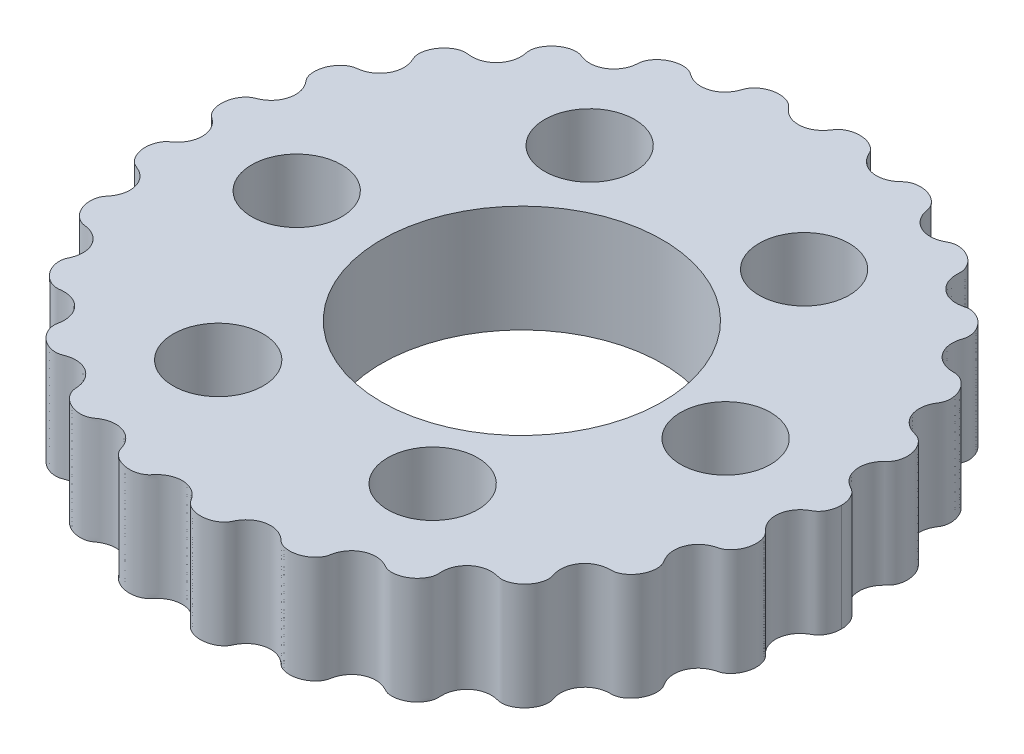
from build123d import *

# Parameters (mm, degrees)
BOSS_EXTRUDE2_DEPTH = 5
SKETCH3_R           = 2.1
CUT_EXTRUDE1_DEPTH  = 23.948222063
SKETCH5_R           = 6.55
CUT_EXTRUDE3_DEPTH  = 23.948222063


with BuildPart() as part:
    # Sketch2 → Boss-Extrude2 (new body)
    with BuildSketch(Plane(origin=(0, 0, 0), x_dir=(1, 0, 0), z_dir=(0, 1, 0))):
        with BuildLine():
            add(Edge.make_bspline(
                [(-15.4, -2.05e-07), (-15.4, 0.017963679), (-15.400999323, 0.054155556), (-15.405496281, 0.123245338), (-15.417452591, 0.205733526), (-15.435300776, 0.284760663), (-15.458936185, 0.363829619), (-15.4955307, 0.460103097), (-15.553831728, 0.577672483), (-15.628963253, 0.690475001), (-15.720523696, 0.795156023), (-15.809877897, 0.878529493), (-15.885972355, 0.939710108), (-15.965266266, 0.996877007), (-16.039390288, 1.060755514), (-16.10181304, 1.136526714), (-16.154322588, 1.219306401), (-16.208602379, 1.329232628), (-16.256294452, 1.468797029), (-16.288096989, 1.63808354), (-16.294503336, 1.881017734), (-16.252297954, 2.119867751), (-16.163760076, 2.344379995), (-16.042398431, 2.523139866), (-15.942454272, 2.628650364), (-15.845311895, 2.703603556), (-15.757199339, 2.750370948), (-15.664408515, 2.786732133), (-15.573413087, 2.826965618), (-15.463621848, 2.885729978), (-15.308968468, 2.990239319), (-15.13050378, 3.165844515), (-14.972147574, 3.434992694), (-14.89398566, 3.773341765), (-14.916927639, 4.080338657), (-14.995171131, 4.310200193), (-15.082412287, 4.468541764), (-15.150259424, 4.567703455), (-15.210025777, 4.642870065), (-15.270573612, 4.717648923), (-15.320176271, 4.800200328), (-15.36541674, 4.910918763), (-15.399338412, 5.049561371), (-15.416852166, 5.262398237), (-15.384340029, 5.500937279), (-15.304055964, 5.731023181), (-15.177986068, 5.941781476), (-15.047854274, 6.095731412), (-14.910789065, 6.208565406), (-14.777136669, 6.28441597), (-14.654566296, 6.325933494), (-14.550559852, 6.341335089), (-14.446683568, 6.355615029), (-14.344145813, 6.378219064), (-14.218558726, 6.416412376), (-14.049117894, 6.490187541), (-13.850381142, 6.623876695), (-13.649361582, 6.848376382), (-13.50607529, 7.152261708), (-13.462998346, 7.451002699), (-13.489971844, 7.692058116), (-13.539204569, 7.862350249), (-13.580286552, 7.968000164), (-13.618269725, 8.050352521), (-13.65443537, 8.133644282), (-13.67828368, 8.221362195), (-13.692937865, 8.335980748), (-13.690655581, 8.476153018), (-13.654303068, 8.685493104), (-13.545223723, 8.951238703), (-13.373056916, 9.183722449), (-13.149188349, 9.366304312), (-12.95326403, 9.463317901), (-12.811586107, 9.506241008), (-12.686731421, 9.522483534), (-12.583488536, 9.516968428), (-12.481158126, 9.503432496), (-12.378198478, 9.496858749), (-12.274929031, 9.498212144), (-12.172138274, 9.508022168), (-12.008489772, 9.538189361), (-11.791017897, 9.615836018), (-11.543764774, 9.778691892), (-11.347433701, 10.024277954), (-11.240209052, 10.268607023), (-11.194325561, 10.48424328), (-11.185347518, 10.63842933), (-11.193136479, 10.770509914), (-11.209146045, 10.879533137), (-11.225593068, 10.966239935), (-11.235972294, 11.053921502), (-11.233096176, 11.14231122), (-11.215768639, 11.253425869), (-11.17671565, 11.384209388), (-11.088557126, 11.571772694), (-10.914554894, 11.800570362), (-10.643928844, 12.015790035), (-10.33839362, 12.131431211), (-10.092328194, 12.151919267), (-9.938831237, 12.124722057), (-9.874147717, 12.104917258), (-9.823296606, 12.086266369), (-9.760021597, 12.062210087), (-9.657742328, 12.026792249), (-9.512708413, 11.991319324), (-9.295428084, 11.971044327), (-9.023341942, 12.005783175), (-8.739745299, 12.120020974), (-8.477485928, 12.330308281), (-8.309271038, 12.575785742), (-8.227745393, 12.796401482), (-8.1948474, 12.964651891), (-8.183073105, 13.072922576), (-8.17740986, 13.159951781), (-8.163855827, 13.268191327), (-8.120743916, 13.39614615), (-8.0432114, 13.535731862), (-7.896275203, 13.715388342), (-7.66781755, 13.896296001), (-7.347778675, 14.038712895), (-7.019984799, 14.072733591), (-6.761854836, 14.026889603), (-6.598537752, 13.94382316), (-6.512636177, 13.880074904), (-6.401772898, 13.805680865), (-6.259871428, 13.730304041), (-6.052431118, 13.656485173), (-5.773826741, 13.622953073), (-5.462558714, 13.668320156), (-5.188838656, 13.799904007), (-4.991154662, 13.966547786), (-4.857833571, 14.133925405), (-4.782594943, 14.263162798), (-4.730894945, 14.379946491), (-4.695923057, 14.480037507), (-4.668902972, 14.560560601), (-4.625076134, 14.657310435), (-4.549395662, 14.764706779), (-4.439982262, 14.875186244), (-4.255657314, 15.006022704), (-3.992826379, 15.120143714), (-3.651468642, 15.175703283), (-3.340640219, 15.129055915), (-3.125824404, 15.033764883), (-3.010951871, 14.946774439), (-2.969759148, 14.9090171), (-2.931738805, 14.868052358), (-2.895415691, 14.825542822), (-2.849862842, 14.772583876), (-2.773475602, 14.691023682), (-2.657607027, 14.589329423), (-2.467715998, 14.468701985), (-2.201270048, 14.37482926), (-1.89427587, 14.35178096), (-1.57047246, 14.423576397), (-1.317305205, 14.563243859), (-1.151543926, 14.714093829), (-1.048134922, 14.841768113), (-0.988592191, 14.928872563), (-0.943008577, 15.000049092), (-0.879486202, 15.084516703), (-0.783319076, 15.171116977), (-0.654507939, 15.252081885), (-0.451621785, 15.335583996), (-0.187231229, 15.385412178), (0.083980966, 15.372590745), (0.34498003, 15.297227978), (0.543453883, 15.192187717), (0.66576514, 15.097631003), (0.754670732, 15.002004334), (0.811224908, 14.912765178), (0.848285284, 14.836852539), (0.894840453, 14.742230041), (0.981133228, 14.596440381), (1.130461791, 14.415291499), (1.371747886, 14.237402645), (1.694146893, 14.124303477), (2.005808039, 14.112082013), (2.279803049, 14.174237301), (2.481366279, 14.271328044), (2.607738454, 14.358111968), (2.69285097, 14.429557295), (2.744274129, 14.476276772), (2.785484757, 14.51360244), (2.839037447, 14.557815738), (2.971848233, 14.642560667), (3.209212349, 14.716335796), (3.537870386, 14.723205434), (3.870973416, 14.623309269), (4.119164878, 14.474113069), (4.287203055, 14.31612725), (4.381819525, 14.188748759), (4.441586957, 14.068624232), (4.469754728, 13.963936145), (4.486205479, 13.878817966), (4.510615897, 13.773375535), (4.56278618, 13.611201221), (4.668640388, 13.402850048), (4.861501992, 13.180789946), (5.140858175, 13.003604669), (5.432389302, 12.920478464), (5.707047343, 12.913934821), (5.924587678, 12.957967892), (6.070502919, 13.011925861), (6.171892992, 13.061226214), (6.234172826, 13.094293248), (6.284238606, 13.120335599), (6.348454819, 13.149381948), (6.450393219, 13.181304737), (6.592860436, 13.199324004), (6.822504707, 13.187512872), (7.108179515, 13.101881159), (7.360700323, 12.948080853), (7.564054881, 12.739256693), (7.686860665, 12.541024702), (7.745859353, 12.391332834), (7.771139717, 12.257944233), (7.769723907, 12.148157634), (7.76448914, 12.060598827), (7.763284165, 11.95102404), (7.773134801, 11.821211136), (7.801859753, 11.673188623), (7.87293797, 11.471739396), (8.004528847, 11.249997743), (8.220498532, 11.035105729), (8.499738312, 10.89046096), (8.747534024, 10.836883967), (8.938296488, 10.832212162), (9.067515607, 10.843723213), (9.169837851, 10.860856567), (9.270401728, 10.885914575), (9.371725276, 10.908894391), (9.499541204, 10.914402089), (9.649899787, 10.893031037), (9.864422414, 10.823594428), (10.115447301, 10.670178455), (10.318488658, 10.460804142), (10.461426996, 10.211874299), (10.524753243, 10.013390562), (10.546392192, 9.877676604), (10.54871035, 9.764592768), (10.539340364, 9.676133747), (10.516898828, 9.590205854), (10.48959357, 9.505763383), (10.460576872, 9.398789945), (10.43711637, 9.267753917), (10.428038925, 9.112622995), (10.448899742, 8.891731308), (10.525306811, 8.644377853), (10.68056024, 8.391693218), (10.908335394, 8.189291397), (11.146089938, 8.066430672), (11.351541146, 8.011177283), (11.50904153, 7.991838534), (11.640826934, 7.98945957), (11.746564253, 7.988165256), (11.874375993, 7.96382694), (12.017764746, 7.905878808), (12.169249377, 7.811410828), (12.319018228, 7.674673468), (12.471981875, 7.480513724), (12.581459021, 7.260882467), (12.64401362, 7.026574152), (12.652861265, 6.812938782), (12.636539544, 6.672849171), (12.606445882, 6.560513083), (12.570431516, 6.476445017), (12.52316631, 6.39823655), (12.475169759, 6.320636846), (12.42152338, 6.219947717), (12.352206783, 6.055608513), (12.297223467, 5.817804557), (12.306144255, 5.511230696), (12.418271092, 5.185791349), (12.599550956, 4.937284492), (12.788421931, 4.782569505), (12.950444571, 4.693121486), (13.068010823, 4.644080383), (13.164678459, 4.612080373), (13.263358977, 4.586967272), (13.360622851, 4.556202595), (13.472064743, 4.497212206), (13.590575024, 4.405386665), (13.741515843, 4.240875618), (13.885567918, 3.984038784), (13.960547447, 3.700012334), (13.962477139, 3.409355761), (13.917122724, 3.199363886), (13.864866305, 3.065549292), (13.804762582, 2.961266737), (13.743749695, 2.885984597), (13.673498703, 2.819365), (13.604760054, 2.751452976), (13.541077576, 2.678634064), (13.482882444, 2.601335324), (13.398435151, 2.468447477), (13.309916002, 2.267780509), (13.257239644, 1.991629003), (13.294765521, 1.65270996), (13.415656685, 1.372495963), (13.564768534, 1.180601297), (13.700945725, 1.058516148), (13.801501699, 0.985659878), (13.885953476, 0.933564636), (13.973240527, 0.886145625), (14.05595319, 0.830914197), (14.145346016, 0.745701374), (14.234104588, 0.627875457), (14.302099652, 0.49791573), (14.350570879, 0.359468261), (14.378415715, 0.242179326), (14.393222635, 0.147286921), (14.398767776, 0.063517674), (14.4, 0.021212111), (14.4, -1.99e-07)],
                knots=[0.062565796, 0.062565796, 0.062565796, 0.062565796, 0.062565796, 0.063859973, 0.06515415, 0.066448326, 0.067742503, 0.06903668, 0.070330857, 0.07291921, 0.075992333, 0.077528894, 0.079065456, 0.080602017, 0.082138578, 0.08367514, 0.085211701, 0.086753761, 0.088295822, 0.091379943, 0.094464064, 0.097548185, 0.103528845, 0.106519174, 0.109509504, 0.111075374, 0.112641243, 0.114207112, 0.115772981, 0.117338851, 0.11890472, 0.122036458, 0.127492162, 0.132947866, 0.138255082, 0.143562297, 0.146585003, 0.148096356, 0.149607709, 0.151119061, 0.152630414, 0.154141767, 0.15565312, 0.158617995, 0.161582869, 0.167512619, 0.170668106, 0.173823593, 0.17697908, 0.180134567, 0.181785014, 0.183435461, 0.185085908, 0.186736355, 0.188386802, 0.190037249, 0.193338142, 0.198333612, 0.203329082, 0.208757311, 0.21418554, 0.217038738, 0.218465337, 0.219891935, 0.221318534, 0.222745133, 0.224171732, 0.225598331, 0.22856804, 0.23153775, 0.237477169, 0.243508984, 0.246524892, 0.2495408, 0.251163787, 0.252786774, 0.254409762, 0.256032749, 0.257655736, 0.259278723, 0.26090171, 0.262524697, 0.268116353, 0.273708009, 0.279232337, 0.2819945, 0.284756664, 0.287531357, 0.288918704, 0.290306051, 0.291693397, 0.293080744, 0.294468091, 0.295855437, 0.298751953, 0.301648468, 0.307441499, 0.313806246, 0.320170993, 0.321874543, 0.322726318, 0.323578093, 0.324429868, 0.325281643, 0.326985192, 0.330392292, 0.333799391, 0.338941908, 0.344084424, 0.349371027, 0.354657629, 0.357399899, 0.358771034, 0.360142168, 0.361513303, 0.362884438, 0.365626708, 0.368571539, 0.37151637, 0.377406032, 0.383827609, 0.390249186, 0.391929851, 0.393610516, 0.39529118, 0.396971845, 0.400333174, 0.403694503, 0.409075747, 0.41445699, 0.419832854, 0.422520785, 0.425208717, 0.427878342, 0.429213155, 0.430547968, 0.431882781, 0.433217593, 0.435887219, 0.438758038, 0.441628857, 0.447370496, 0.453780785, 0.460191075, 0.461070296, 0.461949517, 0.462828738, 0.463707959, 0.46458718, 0.465466401, 0.467224842, 0.470741726, 0.47425861, 0.479541903, 0.484825197, 0.489835983, 0.494846769, 0.497503724, 0.498832202, 0.500160679, 0.501489157, 0.502817634, 0.505474589, 0.508247059, 0.511019529, 0.516564468, 0.52227034, 0.525123276, 0.527976212, 0.530631288, 0.531958826, 0.533286364, 0.534613902, 0.53594144, 0.538596516, 0.543936045, 0.549275574, 0.554531257, 0.559786941, 0.563284399, 0.566781857, 0.568530587, 0.569404951, 0.570279316, 0.57115368, 0.572028045, 0.573776774, 0.580152949, 0.586529123, 0.592383377, 0.595310504, 0.598237631, 0.600962992, 0.602325673, 0.603688354, 0.605051034, 0.606413715, 0.609139076, 0.614392618, 0.619646159, 0.624660447, 0.629674735, 0.633223523, 0.636772312, 0.638546707, 0.639433904, 0.640321101, 0.641208298, 0.642095495, 0.64386989, 0.647025799, 0.650181709, 0.656493529, 0.662419511, 0.665382503, 0.668345494, 0.671104535, 0.672484055, 0.673863575, 0.675243096, 0.676622616, 0.679381657, 0.682041398, 0.68470114, 0.690020622, 0.695473381, 0.700926139, 0.704188253, 0.70581931, 0.707450368, 0.709081425, 0.710712482, 0.712343539, 0.713974596, 0.717095441, 0.720216286, 0.726457975, 0.732286917, 0.735201388, 0.738115858, 0.739511278, 0.740906697, 0.742302116, 0.743697535, 0.745092954, 0.746488373, 0.749279211, 0.752059022, 0.754838832, 0.760398454, 0.765423781, 0.770449108, 0.773768675, 0.777088241, 0.778748025, 0.780407808, 0.782067591, 0.783727374, 0.786901153, 0.790074931, 0.793248709, 0.796422487, 0.802397424, 0.805384893, 0.808372361, 0.809807963, 0.811243566, 0.812679168, 0.81411477, 0.815550372, 0.816985974, 0.819857178, 0.825317904, 0.830778629, 0.835989797, 0.841200965, 0.844404173, 0.846005778, 0.847607382, 0.849208986, 0.85081059, 0.852412194, 0.854013798, 0.857107086, 0.860200373, 0.866386948, 0.872352981, 0.875335998, 0.878319014, 0.879839881, 0.881360748, 0.882881615, 0.884402482, 0.885923349, 0.887444216, 0.888965083, 0.890485949, 0.895823145, 0.90116034, 0.906397405, 0.911634469, 0.914757263, 0.91631866, 0.917880057, 0.919441454, 0.921002851, 0.922564248, 0.924125645, 0.927182053, 0.930238461, 0.931766665, 0.933294869, 0.934823073, 0.936351277, 0.936351277, 0.936351277, 0.936351277, 0.936351277], degree=4))
            add(Edge.make_bspline(
                [(-15.4, -2.05e-07), (-15.4, -0.017963884), (-15.400999323, -0.054155761), (-15.405496281, -0.123245542), (-15.417452591, -0.205733731), (-15.435300776, -0.284760868), (-15.458936185, -0.363829823), (-15.4955307, -0.460103301), (-15.553831728, -0.577672687), (-15.628963253, -0.690475206), (-15.720523696, -0.795156227), (-15.809877897, -0.878529698), (-15.885972355, -0.939710312), (-15.965266265, -0.996877212), (-16.039390288, -1.060755718), (-16.10181304, -1.136526919), (-16.154322588, -1.219306606), (-16.208602379, -1.329232833), (-16.256294452, -1.468797234), (-16.288096989, -1.638083744), (-16.294503336, -1.881017939), (-16.252297954, -2.119867956), (-16.163760076, -2.344380199), (-16.042398431, -2.52314007), (-15.942454271, -2.628650568), (-15.845311894, -2.703603761), (-15.757199339, -2.750371153), (-15.664408514, -2.786732338), (-15.573413087, -2.826965823), (-15.463621848, -2.885730183), (-15.308968468, -2.990239523), (-15.130503779, -3.165844719), (-14.972147574, -3.434992898), (-14.893985659, -3.773341969), (-14.916927638, -4.080338861), (-14.99517113, -4.310200397), (-15.082412287, -4.468541969), (-15.150259423, -4.56770366), (-15.210025776, -4.642870269), (-15.270573612, -4.717649127), (-15.32017627, -4.800200532), (-15.365416739, -4.910918968), (-15.399338411, -5.049561575), (-15.416852165, -5.262398441), (-15.384340028, -5.500937484), (-15.304055963, -5.731023385), (-15.177986067, -5.941781681), (-15.047854273, -6.095731617), (-14.910789064, -6.20856561), (-14.777136668, -6.284416174), (-14.654566295, -6.325933698), (-14.550559851, -6.341335293), (-14.446683567, -6.355615233), (-14.344145812, -6.378219268), (-14.218558725, -6.41641258), (-14.049117892, -6.490187745), (-13.850381141, -6.6238769), (-13.649361581, -6.848376586), (-13.506075288, -7.152261912), (-13.462998345, -7.451002903), (-13.489971843, -7.69205832), (-13.539204567, -7.862350453), (-13.58028655, -7.968000368), (-13.618269724, -8.050352725), (-13.654435369, -8.133644486), (-13.678283679, -8.221362399), (-13.692937864, -8.335980953), (-13.690655579, -8.476153222), (-13.654303066, -8.685493308), (-13.545223721, -8.951238907), (-13.373056915, -9.183722653), (-13.149188347, -9.366304516), (-12.953264028, -9.463318105), (-12.811586105, -9.506241211), (-12.68673142, -9.522483738), (-12.583488535, -9.516968632), (-12.481158125, -9.5034327), (-12.378198476, -9.496858953), (-12.27492903, -9.498212348), (-12.172138273, -9.508022372), (-12.00848977, -9.538189565), (-11.791017895, -9.615836221), (-11.543764772, -9.778692095), (-11.347433699, -10.024278158), (-11.24020905, -10.268607226), (-11.19432556, -10.484243483), (-11.185347516, -10.638429533), (-11.193136478, -10.770510118), (-11.209146043, -10.879533341), (-11.225593066, -10.966240139), (-11.235972293, -11.053921705), (-11.233096174, -11.142311423), (-11.215768637, -11.253426073), (-11.176715648, -11.384209592), (-11.088557124, -11.571772898), (-10.914554892, -11.800570566), (-10.643928842, -12.015790239), (-10.338393618, -12.131431414), (-10.092328191, -12.151919471), (-9.938831235, -12.12472226), (-9.874147715, -12.104917462), (-9.823296604, -12.086266572), (-9.760021595, -12.06221029), (-9.657742326, -12.026792452), (-9.512708411, -11.991319528), (-9.295428082, -11.971044531), (-9.02334194, -12.005783378), (-8.739745297, -12.120021178), (-8.477485926, -12.330308484), (-8.309271036, -12.575785945), (-8.227745391, -12.796401686), (-8.194847398, -12.964652095), (-8.183073102, -13.072922779), (-8.177409857, -13.159951984), (-8.163855825, -13.26819153), (-8.120743913, -13.396146353), (-8.043211398, -13.535732065), (-7.8962752, -13.715388545), (-7.667817547, -13.896296204), (-7.347778673, -14.038713098), (-7.019984797, -14.072733794), (-6.761854834, -14.026889806), (-6.59853775, -13.943823363), (-6.512636175, -13.880075107), (-6.401772895, -13.805681068), (-6.259871426, -13.730304244), (-6.052431116, -13.656485376), (-5.773826739, -13.622953276), (-5.462558712, -13.668320359), (-5.188838654, -13.799904209), (-4.991154659, -13.966547988), (-4.857833569, -14.133925607), (-4.78259494, -14.263163001), (-4.730894943, -14.379946694), (-4.695923054, -14.48003771), (-4.66890297, -14.560560804), (-4.625076131, -14.657310638), (-4.54939566, -14.764706982), (-4.439982259, -14.875186446), (-4.255657312, -15.006022907), (-3.992826377, -15.120143916), (-3.651468639, -15.175703486), (-3.340640217, -15.129056117), (-3.125824401, -15.033765085), (-3.010951868, -14.946774641), (-2.969759145, -14.909017302), (-2.931738803, -14.86805256), (-2.895415689, -14.825543024), (-2.84986284, -14.772584078), (-2.7734756, -14.691023884), (-2.657607025, -14.589329625), (-2.467715995, -14.468702187), (-2.201270046, -14.374829462), (-1.894275868, -14.351781162), (-1.570472458, -14.423576599), (-1.317305203, -14.563244061), (-1.151543923, -14.714094031), (-1.04813492, -14.841768315), (-0.988592189, -14.928872765), (-0.943008575, -15.000049294), (-0.879486199, -15.084516905), (-0.783319073, -15.171117179), (-0.654507937, -15.252082087), (-0.451621783, -15.335584197), (-0.187231226, -15.38541238), (0.083980968, -15.372590947), (0.344980032, -15.297228179), (0.543453885, -15.192187918), (0.665765143, -15.097631204), (0.754670734, -15.002004536), (0.81122491, -14.91276538), (0.848285287, -14.836852741), (0.894840455, -14.742230243), (0.98113323, -14.596440583), (1.130461793, -14.415291701), (1.371747889, -14.237402846), (1.694146896, -14.124303678), (2.005808041, -14.112082215), (2.279803051, -14.174237503), (2.481366281, -14.271328245), (2.607738457, -14.358112169), (2.692850973, -14.429557496), (2.744274132, -14.476276974), (2.785484759, -14.513602641), (2.83903745, -14.557815939), (2.971848236, -14.642560868), (3.209212351, -14.716335997), (3.537870388, -14.723205635), (3.870973419, -14.62330947), (4.11916488, -14.47411327), (4.287203058, -14.316127451), (4.381819528, -14.18874896), (4.44158696, -14.068624433), (4.46975473, -13.963936346), (4.486205481, -13.878818167), (4.510615899, -13.773375736), (4.562786182, -13.611201422), (4.66864039, -13.402850249), (4.861501994, -13.180790147), (5.140858177, -13.00360487), (5.432389304, -12.920478664), (5.707047345, -12.913935022), (5.924587681, -12.957968092), (6.070502921, -13.011926061), (6.171892994, -13.061226415), (6.234172828, -13.094293449), (6.284238608, -13.1203358), (6.348454821, -13.149382149), (6.450393222, -13.181304937), (6.592860438, -13.199324204), (6.822504709, -13.187513073), (7.108179517, -13.101881359), (7.360700325, -12.948081053), (7.564054883, -12.739256894), (7.686860667, -12.541024903), (7.745859355, -12.391333035), (7.771139719, -12.257944434), (7.76972391, -12.148157835), (7.764489142, -12.060599028), (7.763284167, -11.95102424), (7.773134803, -11.821211337), (7.801859755, -11.673188823), (7.872937972, -11.471739597), (8.004528849, -11.249997944), (8.220498534, -11.035105929), (8.499738314, -10.89046116), (8.747534026, -10.836884168), (8.93829649, -10.832212363), (9.067515609, -10.843723414), (9.169837853, -10.860856768), (9.27040173, -10.885914775), (9.371725278, -10.908894591), (9.499541205, -10.914402289), (9.649899789, -10.893031237), (9.864422416, -10.823594629), (10.115447303, -10.670178655), (10.318488659, -10.460804342), (10.461426998, -10.211874499), (10.524753244, -10.013390762), (10.546392194, -9.877676804), (10.548710352, -9.764592968), (10.539340366, -9.676133947), (10.516898829, -9.590206054), (10.489593571, -9.505763583), (10.460576873, -9.398790145), (10.437116372, -9.267754117), (10.428038926, -9.112623195), (10.448899743, -8.891731508), (10.525306813, -8.644378053), (10.680560241, -8.391693418), (10.908335396, -8.189291597), (11.146089939, -8.066430872), (11.351541147, -8.011177483), (11.509041531, -7.991838734), (11.640826936, -7.98945977), (11.746564255, -7.988165456), (11.874375994, -7.96382714), (12.017764748, -7.905879008), (12.169249379, -7.811411027), (12.319018229, -7.674673667), (12.471981877, -7.480513924), (12.581459023, -7.260882666), (12.644013621, -7.026574351), (12.652861266, -6.812938981), (12.636539545, -6.672849371), (12.606445884, -6.560513283), (12.570431517, -6.476445217), (12.523166311, -6.39823675), (12.47516976, -6.320637046), (12.421523381, -6.219947917), (12.352206784, -6.055608712), (12.297223468, -5.817804757), (12.306144256, -5.511230895), (12.418271093, -5.185791549), (12.599550957, -4.937284691), (12.788421932, -4.782569705), (12.950444572, -4.693121686), (13.068010823, -4.644080583), (13.16467846, -4.612080573), (13.263358978, -4.586967472), (13.360622852, -4.556202795), (13.472064743, -4.497212405), (13.590575025, -4.405386865), (13.741515844, -4.240875817), (13.885567919, -3.984038984), (13.960547448, -3.700012534), (13.96247714, -3.40935596), (13.917122724, -3.199364085), (13.864866306, -3.065549492), (13.804762582, -2.961266936), (13.743749695, -2.885984796), (13.673498703, -2.819365199), (13.604760055, -2.751453176), (13.541077577, -2.678634264), (13.482882445, -2.601335524), (13.398435152, -2.468447677), (13.309916002, -2.267780709), (13.257239645, -1.991629203), (13.294765521, -1.652710159), (13.415656685, -1.372496163), (13.564768534, -1.180601497), (13.700945726, -1.058516348), (13.801501699, -0.985660077), (13.885953477, -0.933564835), (13.973240527, -0.886145824), (14.05595319, -0.830914396), (14.145346016, -0.745701573), (14.234104588, -0.627875656), (14.302099652, -0.49791593), (14.350570879, -0.35946846), (14.378415715, -0.242179525), (14.393222635, -0.147287121), (14.398767777, -0.063517873), (14.4, -0.021212311), (14.4, -1.99e-07)],
                knots=[0.062565796, 0.062565796, 0.062565796, 0.062565796, 0.062565796, 0.063859973, 0.06515415, 0.066448326, 0.067742503, 0.06903668, 0.070330857, 0.07291921, 0.075992333, 0.077528894, 0.079065456, 0.080602017, 0.082138578, 0.08367514, 0.085211701, 0.086753761, 0.088295822, 0.091379943, 0.094464064, 0.097548185, 0.103528845, 0.106519174, 0.109509504, 0.111075374, 0.112641243, 0.114207112, 0.115772981, 0.117338851, 0.11890472, 0.122036458, 0.127492162, 0.132947866, 0.138255082, 0.143562297, 0.146585003, 0.148096356, 0.149607709, 0.151119061, 0.152630414, 0.154141767, 0.15565312, 0.158617995, 0.161582869, 0.167512619, 0.170668106, 0.173823593, 0.17697908, 0.180134567, 0.181785014, 0.183435461, 0.185085908, 0.186736355, 0.188386802, 0.190037249, 0.193338142, 0.198333612, 0.203329082, 0.208757311, 0.21418554, 0.217038738, 0.218465337, 0.219891935, 0.221318534, 0.222745133, 0.224171732, 0.225598331, 0.22856804, 0.23153775, 0.237477169, 0.243508984, 0.246524892, 0.2495408, 0.251163787, 0.252786774, 0.254409762, 0.256032749, 0.257655736, 0.259278723, 0.26090171, 0.262524697, 0.268116353, 0.273708009, 0.279232337, 0.2819945, 0.284756664, 0.287531357, 0.288918704, 0.290306051, 0.291693397, 0.293080744, 0.294468091, 0.295855437, 0.298751953, 0.301648468, 0.307441499, 0.313806246, 0.320170993, 0.321874543, 0.322726318, 0.323578093, 0.324429868, 0.325281643, 0.326985192, 0.330392292, 0.333799391, 0.338941908, 0.344084424, 0.349371027, 0.354657629, 0.357399899, 0.358771034, 0.360142168, 0.361513303, 0.362884438, 0.365626708, 0.368571539, 0.37151637, 0.377406032, 0.383827609, 0.390249186, 0.391929851, 0.393610516, 0.39529118, 0.396971845, 0.400333174, 0.403694503, 0.409075747, 0.41445699, 0.419832854, 0.422520785, 0.425208717, 0.427878342, 0.429213155, 0.430547968, 0.431882781, 0.433217593, 0.435887219, 0.438758038, 0.441628857, 0.447370496, 0.453780785, 0.460191075, 0.461070296, 0.461949517, 0.462828738, 0.463707959, 0.46458718, 0.465466401, 0.467224842, 0.470741726, 0.47425861, 0.479541903, 0.484825197, 0.489835983, 0.494846769, 0.497503724, 0.498832202, 0.500160679, 0.501489157, 0.502817634, 0.505474589, 0.508247059, 0.511019529, 0.516564468, 0.52227034, 0.525123276, 0.527976212, 0.530631288, 0.531958826, 0.533286364, 0.534613902, 0.53594144, 0.538596516, 0.543936045, 0.549275574, 0.554531257, 0.559786941, 0.563284399, 0.566781857, 0.568530587, 0.569404951, 0.570279316, 0.57115368, 0.572028045, 0.573776774, 0.580152949, 0.586529123, 0.592383377, 0.595310504, 0.598237631, 0.600962992, 0.602325673, 0.603688354, 0.605051034, 0.606413715, 0.609139076, 0.614392618, 0.619646159, 0.624660447, 0.629674735, 0.633223523, 0.636772312, 0.638546707, 0.639433904, 0.640321101, 0.641208298, 0.642095495, 0.64386989, 0.647025799, 0.650181709, 0.656493529, 0.662419511, 0.665382503, 0.668345494, 0.671104535, 0.672484055, 0.673863575, 0.675243096, 0.676622616, 0.679381657, 0.682041398, 0.68470114, 0.690020622, 0.695473381, 0.700926139, 0.704188253, 0.70581931, 0.707450368, 0.709081425, 0.710712482, 0.712343539, 0.713974596, 0.717095441, 0.720216286, 0.726457975, 0.732286917, 0.735201388, 0.738115858, 0.739511278, 0.740906697, 0.742302116, 0.743697535, 0.745092954, 0.746488373, 0.749279211, 0.752059022, 0.754838832, 0.760398454, 0.765423781, 0.770449108, 0.773768675, 0.777088241, 0.778748025, 0.780407808, 0.782067591, 0.783727374, 0.786901153, 0.790074931, 0.793248709, 0.796422487, 0.802397424, 0.805384893, 0.808372361, 0.809807963, 0.811243566, 0.812679168, 0.81411477, 0.815550372, 0.816985974, 0.819857178, 0.825317904, 0.830778629, 0.835989797, 0.841200965, 0.844404173, 0.846005778, 0.847607382, 0.849208986, 0.85081059, 0.852412194, 0.854013798, 0.857107086, 0.860200373, 0.866386948, 0.872352981, 0.875335998, 0.878319014, 0.879839881, 0.881360748, 0.882881615, 0.884402482, 0.885923349, 0.887444216, 0.888965083, 0.890485949, 0.895823145, 0.90116034, 0.906397405, 0.911634469, 0.914757263, 0.91631866, 0.917880057, 0.919441454, 0.921002851, 0.922564248, 0.924125645, 0.927182053, 0.930238461, 0.931766665, 0.933294869, 0.934823073, 0.936351277, 0.936351277, 0.936351277, 0.936351277, 0.936351277], degree=4))
        make_face()
    extrude(amount=-BOSS_EXTRUDE2_DEPTH)

    # Sketch3 → Cut-Extrude1 (cut, through all)
    with BuildSketch(Plane(origin=(0, 0, 0), x_dir=(1, 0, 0), z_dir=(0, 1, 0))):
        with Locations((-6, 8.660254038)):
            Circle(SKETCH3_R)
        with Locations((4, 8.660254038)):
            Circle(SKETCH3_R)
        with Locations((9, 0)):
            Circle(SKETCH3_R)
        with Locations((4, -8.660254038)):
            Circle(SKETCH3_R)
        with Locations((-6, -8.660254038)):
            Circle(SKETCH3_R)
        with Locations((-11, 0)):
            Circle(SKETCH3_R)
    extrude(amount=-CUT_EXTRUDE1_DEPTH, mode=Mode.SUBTRACT)

    # Sketch5 → Cut-Extrude3 (cut, through all)
    with BuildSketch(Plane(origin=(0, 0, 0), x_dir=(1, 0, 0), z_dir=(0, 1, 0))):
        with Locations((-0.5, 0)):
            Circle(SKETCH5_R)
    extrude(amount=-CUT_EXTRUDE3_DEPTH, mode=Mode.SUBTRACT)


solid = part.part
